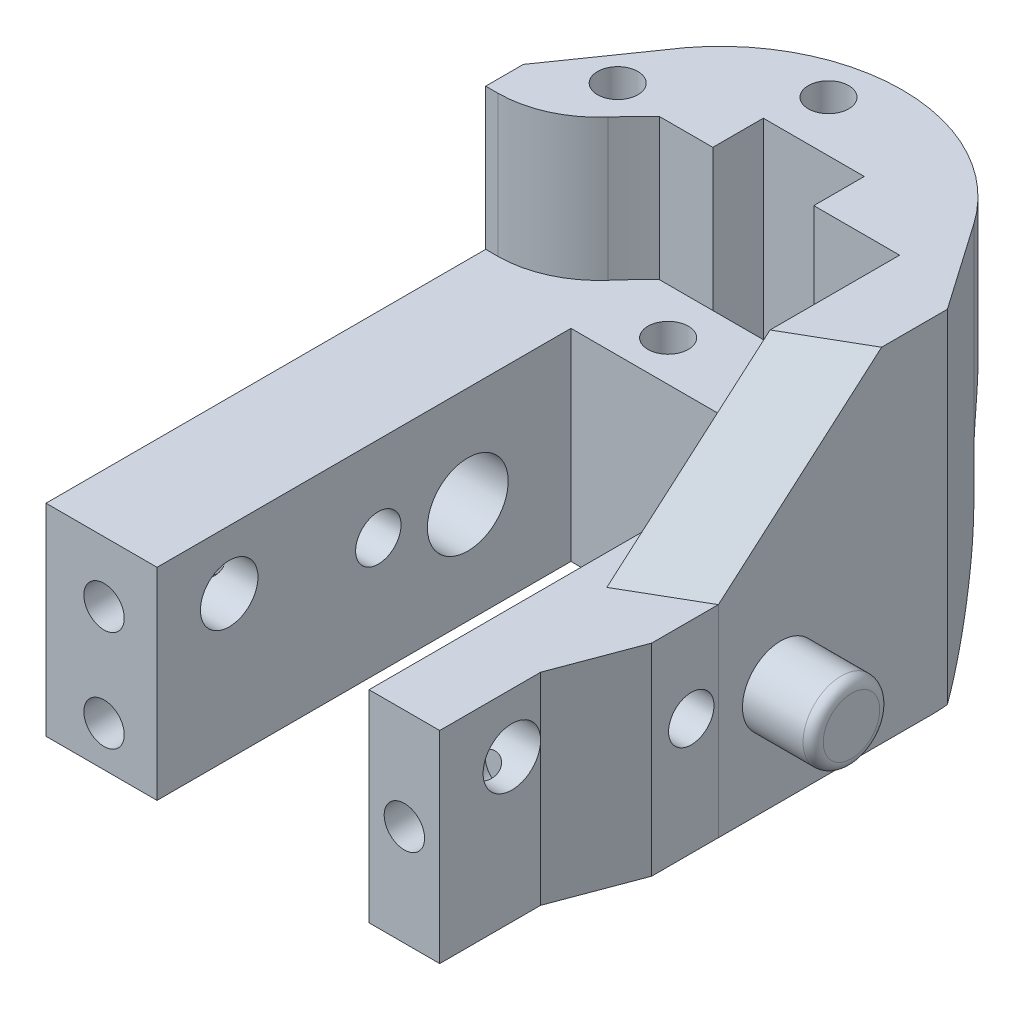
from build123d import *

# Parameters (mm, degrees)
BOSS_EXTRUDE1_DEPTH             = 20
SKETCH6_W                       = 25
SKETCH6_H                       = 20
BOSS_EXTRUDE5_DEPTH             = 5.5
BOSS_EXTRUDE11_START            = -20
BOSS_EXTRUDE11_DEPTH            = 34
SKETCH4_R                       = 2
CUT_EXTRUDE1_DEPTH              = 10
BOSS_EXTRUDE13_DEPTH            = 12
FILLET11_START                  = 14.0499999
FILLET11_DEPTH                  = 7.9500001
FILLET11_START_2                = -14.996842371
FILLET11_2_DEPTH                = 30.996842371
SKETCH22_R                      = 2
CUT_EXTRUDE6_DEPTH              = 10
CHAMFER1_SIZE                   = 14
SKETCH26_W                      = 22
SKETCH26_H                      = 20
BOSS_EXTRUDE14_DEPTH            = 11
CUT_EXTRUDE7_DEPTH              = 2.5
CUT_EXTRUDE8_REACH              = 65.92
SKETCH27_R                      = 4
SKETCH27_R_2                    = 1.15
SKETCH27_R_3                    = 1.6
CUT_EXTRUDE9_DEPTH              = 2.5
BOSS_EXTRUDE15_DEPTH            = 1
BOSS_EXTRUDE15_DEPTH_BACK       = 2
SKETCH31_R                      = 4
SKETCH31_R_2                    = 1.65
SKETCH32_R                      = 2.85
SKETCH32_R_2                    = 2.25
CUT_EXTRUDE12_DEPTH             = 7
CUT_EXTRUDE12_DIRECTION_2_REACH = 61.046
SKETCH33_R                      = 3.8
BOSS_EXTRUDE17_DEPTH            = 7
FILLET17_R                      = 1
CUT_EXTRUDE13_DEPTH             = 14
SKETCH36_R                      = 2
CUT_EXTRUDE14_DEPTH             = 10
FILLET18_R                      = 10
CUT_EXTRUDE16_REACH             = 67.49
SKETCH37_W                      = 5.717933373
SKETCH37_H                      = 6
CHAMFER2_SIZE                   = 7
SKETCH38_W                      = 10
SKETCH38_H                      = 20
CUT_EXTRUDE17_DEPTH             = 4
CUT_EXTRUDE19_REACH             = 59.527
SKETCH39_W                      = 10
SKETCH39_H                      = 5


with BuildPart() as part:
    # Sketch1 → Boss-Extrude1 (new body)
    with BuildSketch(Plane(origin=(0, 0, 0), x_dir=(1, 0, 0), z_dir=(0, 1, 0))):
        Polygon((-15.5, -37), (-10, -37), (-10, 4), (11, 4), (11, -37), (18, -37), (18, -27), (21, -19), (21, 10), (-15.5, 10), align=None)
    extrude(amount=BOSS_EXTRUDE1_DEPTH)

    # Sketch6 → Boss-Extrude5 (add)
    with BuildSketch(Plane.ZY.offset(15.5)):
        with Locations((2.5, 10)):
            Rectangle(SKETCH6_W, SKETCH6_H)
    extrude(amount=BOSS_EXTRUDE5_DEPTH)

    # Sketch20 → Boss-Extrude11 (add)
    with BuildSketch(Plane(origin=(0, 20, 0), x_dir=(1, 0, 0), z_dir=(0, 1, 0)).offset(BOSS_EXTRUDE11_START)):
        Polygon((-21, 6.554166441), (14, 6.554166441), (14, -16.445833559), (21.006315459, -12.400735443), (21.006315459, 10.282066627), (15.003157729, 18.901571597), (-14.996842271, 18.901571597), (-21, 10.282066627), align=None)
    extrude(amount=BOSS_EXTRUDE11_DEPTH)

    # Sketch4 → Cut-Extrude1 (cut)
    with BuildSketch(Plane(origin=(0, 20, 0), x_dir=(1, 0, 0), z_dir=(0, 1, 0))):
        with Locations(Location((-4.375, 8, 0), (0, 0, 270))):
            Circle(SKETCH4_R)
        with Locations(Location((5.375, 8, 0), (0, 0, 270))):
            Circle(SKETCH4_R)
    extrude(amount=-CUT_EXTRUDE1_DEPTH, mode=Mode.SUBTRACT)

    # Sketch24 → Boss-Extrude13 (add)
    with BuildSketch(Plane(origin=(0, 34, 0), x_dir=(1, 0, 0), z_dir=(0, 1, 0))):
        with BuildLine():
            Line((-14.996842271, 18.901571597), (-14.420936492, 19.728473528))
            ThreePointArc((-14.420936492, 19.728473528), (-3.81756267, 26.467738085), (8.613124034, 24.643662635))
            ThreePointArc((8.613124034, 24.643662635), (12.140366622, 22.142331504), (15.003157729, 18.901571597))
            Line((15.003157729, 18.901571597), (21.006315459, 10.282066627))
            Line((21.006315459, 10.282066627), (21.006315459, 6.554166441))
            Line((21.006315459, 6.554166441), (-21, 6.554166441))
            Line((-21, 6.554166441), (-21, 10.282066627))
            Line((-21, 10.282066627), (-14.996842271, 18.901571597))
        make_face()
    extrude(amount=-BOSS_EXTRUDE13_DEPTH)

    # Fillet11: read off the stored shape, not the designer's step
    # Fillet11 outline → Fillet11 (add)
    with BuildSketch(Plane(origin=(0, 0, 0), x_dir=(1, 0, 0), z_dir=(0, 1, 0)).offset(FILLET11_START)):
        with BuildLine():
            Line((-14.996842271, 18.901571597), (15.003161757, 18.901565813))
            ThreePointArc((15.003161757, 18.901565813), (12.140369243, 22.142329149), (8.613124034, 24.643662635))
            ThreePointArc((8.613124034, 24.643662635), (-3.81756267, 26.467738085), (-14.420936492, 19.728473528))
            Line((-14.420936492, 19.728473528), (-14.996842271, 18.901571597))
        make_face()
    extrude(amount=FILLET11_DEPTH)

    # Fillet11 2 outline → Fillet11 2 (cut)
    with BuildSketch(Plane.YZ.offset(FILLET11_START_2)):
        with BuildLine():
            Line((22, -28), (22, -26.851571597))
            ThreePointArc((22, -26.851571597), (19.67149891, -21.230072687), (14.05, -18.901571597))
            Line((14.05, -18.901571597), (14.0499999, -28))
            Line((14.0499999, -28), (22, -28))
        make_face()
    extrude(amount=FILLET11_2_DEPTH, mode=Mode.SUBTRACT)

    # Sketch22 → Cut-Extrude6 (cut)
    with BuildSketch(Plane(origin=(0, 34, 0), x_dir=(1, 0, 0), z_dir=(0, 1, 0))):
        with Locations(Location((-14.720302421, 13.351367671, 0), (0, 0, 270))):
            Circle(SKETCH22_R)
        with Locations(Location((-3.067324575, 22.581252689, 0), (0, 0, 270))):
            Circle(SKETCH22_R)
    extrude(amount=-CUT_EXTRUDE6_DEPTH, mode=Mode.SUBTRACT)

    # Chamfer1
    chamfer1_edges = [part.edges().sort_by_distance(p)[0] for p in [
        (17.503157729, 34, 14.423284501),
    ]]
    chamfer(chamfer1_edges, length=CHAMFER1_SIZE)

    # Sketch26 → Boss-Extrude14 (add)
    with BuildSketch(Plane.ZY.offset(21)):
        with Locations((26, 10)):
            Rectangle(SKETCH26_W, SKETCH26_H)
    extrude(amount=-BOSS_EXTRUDE14_DEPTH)

    # Sketch25 → Cut-Extrude7 (cut)
    with BuildSketch(Plane.ZY.offset(21)):
        with BuildLine():
            Line((11.868890963, 14.931194411), (31.150048263, 18.330982662))
            ThreePointArc((31.150048263, 18.330982662), (35.639064994, 15.187739308), (32.49582164, 10.698722576))
            Line((32.49582164, 10.698722576), (13.21466434, 7.298934325))
            ThreePointArc((13.21466434, 7.298934325), (-1.168124774, 8.697638667), (11.868890963, 14.931194411))
        make_face()
    extrude(amount=-CUT_EXTRUDE7_DEPTH, mode=Mode.SUBTRACT)

    # Sketch27 → Cut-Extrude8 (cut, up to next)
    with BuildSketch(Plane.ZY.offset(18.5), mode=Mode.PRIVATE) as cut_extrude8_sk1:
        with Locations((6.217933373, 10)):
            Circle(SKETCH27_R)
    cut_extrude8_tool1 = extrude(cut_extrude8_sk1.sketch, amount=-CUT_EXTRUDE8_REACH, mode=Mode.PRIVATE) & part.part
    # Sketch27 → Cut-Extrude8 (cut, up to next)
    with BuildSketch(Plane.ZY.offset(18.5), mode=Mode.PRIVATE) as cut_extrude8_sk2:
        with Locations((15.08120315, 11.562833599)):
            Circle(SKETCH27_R_2)
    cut_extrude8_tool2 = extrude(cut_extrude8_sk2.sketch, amount=-CUT_EXTRUDE8_REACH, mode=Mode.PRIVATE) & part.part
    # Sketch27 → Cut-Extrude8 (cut, up to next)
    with BuildSketch(Plane.ZY.offset(18.5), mode=Mode.PRIVATE) as cut_extrude8_sk3:
        with Locations((29.853319446, 14.167556264)):
            Circle(SKETCH27_R_3)
    cut_extrude8_tool3 = extrude(cut_extrude8_sk3.sketch, amount=-CUT_EXTRUDE8_REACH, mode=Mode.PRIVATE) & part.part
    add(cut_extrude8_tool1.solids().sort_by_distance((-18.5, 10, 6.217933))[0], mode=Mode.SUBTRACT)
    add(cut_extrude8_tool2.solids().sort_by_distance((-18.5, 11.562834, 15.081203))[0], mode=Mode.SUBTRACT)
    add(cut_extrude8_tool3.solids().sort_by_distance((-18.5, 14.167556, 29.853319))[0], mode=Mode.SUBTRACT)

    # Sketch28 → Cut-Extrude9 (cut)
    with BuildSketch(Plane.ZY.offset(21)):
        Polygon((-0.028318142, 0.777915528), (-3.197748963, 15.950413947), (10.506443157, 18.813125656), (17.248705835, 15.879800924), (18.680061689, 9.027704864), (13.675873978, 3.640627238), align=None)
    extrude(amount=-CUT_EXTRUDE9_DEPTH, mode=Mode.SUBTRACT)

    # Sketch31 → Boss-Extrude15 (add, two sides: drawn at the far end of the back side and taken through both)
    with BuildSketch(Plane.ZY.offset(18.5).offset(-BOSS_EXTRUDE15_DEPTH_BACK)):
        with Locations((6.217933373, 10)):
            Circle(SKETCH31_R)
        with Locations((6.217933373, 10)):
            Circle(SKETCH31_R_2, mode=Mode.SUBTRACT)
    extrude(amount=BOSS_EXTRUDE15_DEPTH + BOSS_EXTRUDE15_DEPTH_BACK)

    # Sketch32 → Cut-Extrude12 (cut)
    with BuildSketch(Plane(origin=(-10, 0, 0), x_dir=(0, 0, -1), z_dir=(1, 0, 0))):
        with Locations((-29.853319446, 14.167556264)):
            Circle(SKETCH32_R)
        with Locations((-15.08120315, 11.562833599)):
            Circle(SKETCH32_R_2)
    extrude(amount=-CUT_EXTRUDE12_DEPTH, mode=Mode.SUBTRACT)

    # Sketch32 → Cut-Extrude12 direction 2 (cut, up to next)
    with BuildSketch(Plane(origin=(-10, 0, 0), x_dir=(0, 0, -1), z_dir=(1, 0, 0)), mode=Mode.PRIVATE) as cut_extrude12_direction_2_sk1:
        with Locations((-29.853319446, 14.167556264)):
            Circle(SKETCH32_R)
    cut_extrude12_direction_2_tool1 = extrude(cut_extrude12_direction_2_sk1.sketch, amount=CUT_EXTRUDE12_DIRECTION_2_REACH, mode=Mode.PRIVATE) & part.part
    # Sketch32 → Cut-Extrude12 direction 2 (cut, up to next)
    with BuildSketch(Plane(origin=(-10, 0, 0), x_dir=(0, 0, -1), z_dir=(1, 0, 0)), mode=Mode.PRIVATE) as cut_extrude12_direction_2_sk2:
        with Locations((-15.08120315, 11.562833599)):
            Circle(SKETCH32_R_2)
    cut_extrude12_direction_2_tool2 = extrude(cut_extrude12_direction_2_sk2.sketch, amount=CUT_EXTRUDE12_DIRECTION_2_REACH, mode=Mode.PRIVATE) & part.part
    add(cut_extrude12_direction_2_tool1.solids().sort_by_distance((-10, 14.167556, 29.853319))[0], mode=Mode.SUBTRACT)
    add(cut_extrude12_direction_2_tool2.solids().sort_by_distance((-10, 11.562834, 15.081203))[0], mode=Mode.SUBTRACT)

    # Sketch33 → Boss-Extrude17 (add)
    with BuildSketch(Plane(origin=(21.006315459, 0, 0), x_dir=(0, 0, -1), z_dir=(1, 0, 0))):
        with Locations((-6.217933373, 10)):
            Circle(SKETCH33_R)
    extrude(amount=BOSS_EXTRUDE17_DEPTH)

    # Fillet17
    fillet17_edges = [part.edges().sort_by_distance(p)[0] for p in [
        (28.006315459, 10, 10.017933373),
    ]]
    fillet(fillet17_edges, radius=FILLET17_R)

    # Sketch35 → Cut-Extrude13 (cut)
    with BuildSketch(Plane(origin=(0, 34, 0), x_dir=(1, 0, 0), z_dir=(0, 1, 0))):
        with BuildLine():
            Line((-19.79995418, 6.554166441), (14, 6.554166441))
            Line((14, 6.554166441), (14, 12.554166441))
            Line((14, 12.554166441), (-9.802737675, 12.554166441))
            ThreePointArc((-9.802737675, 12.554166441), (-11.071315957, 11.28171537), (-12.284990593, 9.956794065))
            ThreePointArc((-12.284990593, 9.956794065), (-15.675255632, 7.444453939), (-19.79995418, 6.554166441))
        make_face()
    extrude(amount=-CUT_EXTRUDE13_DEPTH, mode=Mode.SUBTRACT)

    # Sketch36 → Cut-Extrude14 (cut)
    with BuildSketch(Plane.XY.offset(37)):
        with Locations((-15.25, 14)):
            Circle(SKETCH36_R)
        with Locations((14.5, 10)):
            Circle(SKETCH36_R)
        with Locations((-15.25, 4)):
            Circle(SKETCH36_R)
    extrude(amount=-CUT_EXTRUDE14_DEPTH, mode=Mode.SUBTRACT)

    # Fillet18
    fillet18_edges = [part.edges().sort_by_distance(p)[0] for p in [
        (0.003157729, 0, -18.901571597),
    ]]
    fillet(fillet18_edges, radius=FILLET18_R)

    # Sketch37 → Cut-Extrude16 (cut, up to next)
    with BuildSketch(Plane(origin=(21, 0, 0), x_dir=(0, 0, -1), z_dir=(1, 0, 0)), mode=Mode.PRIVATE) as cut_extrude16_sk1:
        with Locations((1.141033313, 10)):
            Rectangle(SKETCH37_W, SKETCH37_H)
    cut_extrude16_tool1 = extrude(cut_extrude16_sk1.sketch, amount=-CUT_EXTRUDE16_REACH, mode=Mode.PRIVATE) & part.part
    add(cut_extrude16_tool1.solids().sort_by_distance((21, 10, -1.141033))[0], mode=Mode.SUBTRACT)

    # Chamfer2
    chamfer2_edges = [part.edges().sort_by_distance(p)[0] for p in [
        (11, 10, 1.717933373),
    ]]
    chamfer(chamfer2_edges, length=CHAMFER2_SIZE)

    # Sketch38 → Cut-Extrude17 (cut)
    with BuildSketch(Plane.XZ):
        with Locations((0.5, -14)):
            Rectangle(SKETCH38_W, SKETCH38_H)
    extrude(amount=-CUT_EXTRUDE17_DEPTH, mode=Mode.SUBTRACT)

    # Sketch39 → Cut-Extrude19 (cut, up to next)
    with BuildSketch(Plane(origin=(0, 34, 0), x_dir=(1, 0, 0), z_dir=(0, 1, 0)), mode=Mode.PRIVATE) as cut_extrude19_sk1:
        with Locations((0.5, 15.054166441)):
            Rectangle(SKETCH39_W, SKETCH39_H)
    cut_extrude19_tool1 = extrude(cut_extrude19_sk1.sketch, amount=-CUT_EXTRUDE19_REACH, mode=Mode.PRIVATE) & part.part
    add(cut_extrude19_tool1.solids().sort_by_distance((0.5, 34, -15.054166))[0], mode=Mode.SUBTRACT)


solid = part.part
